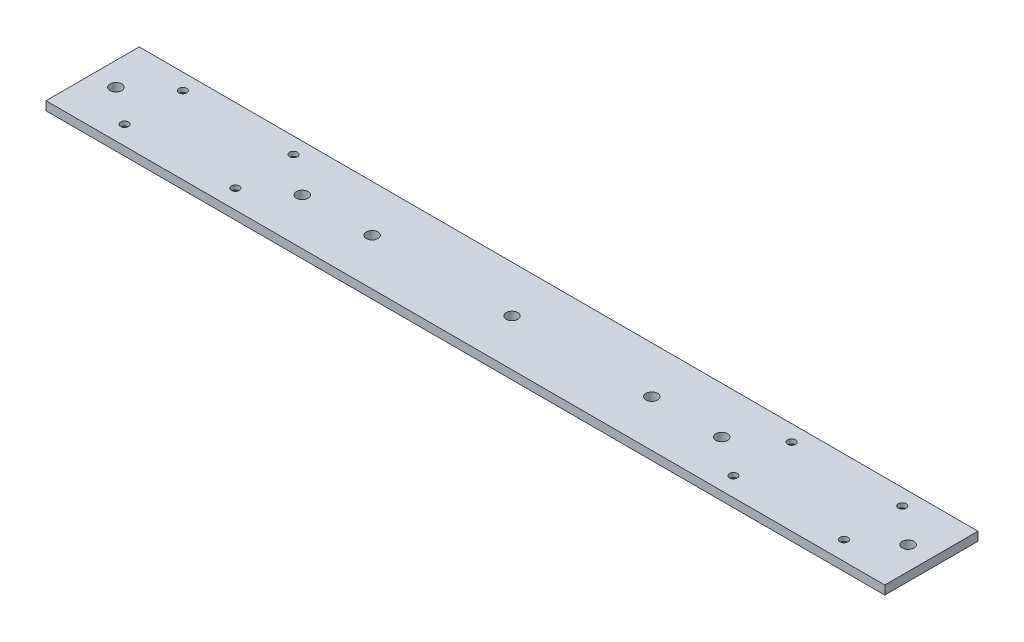
from build123d import *

# Parameters (mm, degrees)
SKETCH1_W                                     = 457.2
SKETCH1_H                                     = 50.8
BOSS_EXTRUDE1_DEPTH                           = 4.7625
SKETCH2_R                                     = 3.175
CUT_EXTRUDE1_DEPTH                            = 244.602
SKETCH3_R                                     = 3.175
CUT_EXTRUDE2_DEPTH                            = 244.602
CSK_FOR_8_FLAT_HEAD_MACHINE_SCREW1_AT_2_COUNT = 2
CSK_FOR_8_FLAT_HEAD_MACHINE_SCREW1_AT_2_PITCH = 31.75
CSK_FOR_8_FLAT_HEAD_MACHINE_SCREW1_AT_3_COUNT = 2
CSK_FOR_8_FLAT_HEAD_MACHINE_SCREW1_AT_3_PITCH = 68.170141008
CSK_FOR_8_FLAT_HEAD_MACHINE_SCREW1_AT_4_COUNT = 2
CSK_FOR_8_FLAT_HEAD_MACHINE_SCREW1_AT_4_PITCH = 60.325
CSK_FOR_8_FLAT_HEAD_MACHINE_SCREW1_AT_5_COUNT = 2
CSK_FOR_8_FLAT_HEAD_MACHINE_SCREW1_AT_5_PITCH = 331.8
CSK_FOR_8_FLAT_HEAD_MACHINE_SCREW1_AT_6_COUNT = 2
CSK_FOR_8_FLAT_HEAD_MACHINE_SCREW1_AT_6_PITCH = 333.315619946
CSK_FOR_8_FLAT_HEAD_MACHINE_SCREW1_AT_7_COUNT = 2
CSK_FOR_8_FLAT_HEAD_MACHINE_SCREW1_AT_7_PITCH = 393.408284261
CSK_FOR_8_FLAT_HEAD_MACHINE_SCREW1_AT_8_COUNT = 2
CSK_FOR_8_FLAT_HEAD_MACHINE_SCREW1_AT_8_PITCH = 392.125
SKETCH4_R                                     = 3.175
CUT_EXTRUDE3_DEPTH                            = 25.4


with BuildPart() as part:
    # Sketch1 → Boss-Extrude1 (new body)
    with BuildSketch(Plane(origin=(0, 0, 0), x_dir=(1, 0, 0), z_dir=(0, 1, 0))):
        with Locations((228.6, 25.4)):
            Rectangle(SKETCH1_W, SKETCH1_H)
    extrude(amount=BOSS_EXTRUDE1_DEPTH)

    # Sketch2 → Cut-Extrude1 (cut)
    with BuildSketch(Plane(origin=(0, 4.7625, 0), x_dir=(1, 0, 0), z_dir=(0, 1, 0))):
        with Locations((12.7, 25.4)):
            Circle(SKETCH2_R)
        with Locations((444.5, 25.4)):
            Circle(SKETCH2_R)
    extrude(amount=-CUT_EXTRUDE1_DEPTH, mode=Mode.SUBTRACT)

    # Sketch3 → Cut-Extrude2 (cut)
    with BuildSketch(Plane(origin=(0, 4.7625, 0), x_dir=(1, 0, 0), z_dir=(0, 1, 0))):
        with Locations((152.4, 25.4)):
            Circle(SKETCH3_R)
        with Locations((304.8, 25.4)):
            Circle(SKETCH3_R)
        with Locations((228.6, 25.4)):
            Circle(SKETCH3_R)
    extrude(amount=-CUT_EXTRUDE2_DEPTH, mode=Mode.SUBTRACT)

    # Sketch7 → CSK for #8 Flat Head Machine Screw1 (revolve, cut)
    with BuildSketch(Plane(origin=(424.6625, 0, -42.06875), x_dir=(0, 0, -1), z_dir=(1, 0, 0))):
        Polygon((0, 0), (0, 4.7625), (2.15265, 4.7625), (2.15265, 2.3740728), (4.2164, 0), align=None)
    csk_for_8_flat_head_machine_screw1 = revolve(axis=Axis((424.6625, -6.35, -42.06875), (0, 1, 0)), mode=Mode.SUBTRACT)

    # CSK for #8 Flat Head Machine Screw1 at 2: CSK for #8 Flat Head Machine Screw1 ×2
    with Locations(*[(0, 0, i * CSK_FOR_8_FLAT_HEAD_MACHINE_SCREW1_AT_2_PITCH) for i in range(1, CSK_FOR_8_FLAT_HEAD_MACHINE_SCREW1_AT_2_COUNT)]):
        add(csk_for_8_flat_head_machine_screw1, mode=Mode.SUBTRACT)

    # CSK for #8 Flat Head Machine Screw1 at 3: CSK for #8 Flat Head Machine Screw1 ×2
    with Locations(*[Vector(-0.8849182223819825, 0, 0.46574643283262224) * (i * CSK_FOR_8_FLAT_HEAD_MACHINE_SCREW1_AT_3_PITCH) for i in range(1, CSK_FOR_8_FLAT_HEAD_MACHINE_SCREW1_AT_3_COUNT)]):
        add(csk_for_8_flat_head_machine_screw1, mode=Mode.SUBTRACT)

    # CSK for #8 Flat Head Machine Screw1 at 4: CSK for #8 Flat Head Machine Screw1 ×2
    with Locations(*[(-i * CSK_FOR_8_FLAT_HEAD_MACHINE_SCREW1_AT_4_PITCH, 0, 0) for i in range(1, CSK_FOR_8_FLAT_HEAD_MACHINE_SCREW1_AT_4_COUNT)]):
        add(csk_for_8_flat_head_machine_screw1, mode=Mode.SUBTRACT)

    # CSK for #8 Flat Head Machine Screw1 at 5: CSK for #8 Flat Head Machine Screw1 ×2
    with Locations(*[(-i * CSK_FOR_8_FLAT_HEAD_MACHINE_SCREW1_AT_5_PITCH, 0, 0) for i in range(1, CSK_FOR_8_FLAT_HEAD_MACHINE_SCREW1_AT_5_COUNT)]):
        add(csk_for_8_flat_head_machine_screw1, mode=Mode.SUBTRACT)

    # CSK for #8 Flat Head Machine Screw1 at 6: CSK for #8 Flat Head Machine Screw1 ×2
    with Locations(*[Vector(-0.9954528985282296, 0, 0.09525506186941606) * (i * CSK_FOR_8_FLAT_HEAD_MACHINE_SCREW1_AT_6_PITCH) for i in range(1, CSK_FOR_8_FLAT_HEAD_MACHINE_SCREW1_AT_6_COUNT)]):
        add(csk_for_8_flat_head_machine_screw1, mode=Mode.SUBTRACT)

    # CSK for #8 Flat Head Machine Screw1 at 7: CSK for #8 Flat Head Machine Screw1 ×2
    with Locations(*[Vector(-0.9967380344743431, 0, 0.0807049603941631) * (i * CSK_FOR_8_FLAT_HEAD_MACHINE_SCREW1_AT_7_PITCH) for i in range(1, CSK_FOR_8_FLAT_HEAD_MACHINE_SCREW1_AT_7_COUNT)]):
        add(csk_for_8_flat_head_machine_screw1, mode=Mode.SUBTRACT)

    # CSK for #8 Flat Head Machine Screw1 at 8: CSK for #8 Flat Head Machine Screw1 ×2
    with Locations(*[(-i * CSK_FOR_8_FLAT_HEAD_MACHINE_SCREW1_AT_8_PITCH, 0, 0) for i in range(1, CSK_FOR_8_FLAT_HEAD_MACHINE_SCREW1_AT_8_COUNT)]):
        add(csk_for_8_flat_head_machine_screw1, mode=Mode.SUBTRACT)

    # Sketch4 → Cut-Extrude3 (cut)
    with BuildSketch(Plane(origin=(0, 4.7625, 0), x_dir=(1, 0, 0), z_dir=(0, 1, 0))):
        with Locations((114.3, 25.4)):
            Circle(SKETCH4_R)
        with Locations((342.9, 25.4)):
            Circle(SKETCH4_R)
    extrude(amount=-CUT_EXTRUDE3_DEPTH, mode=Mode.SUBTRACT)


solid = part.part
